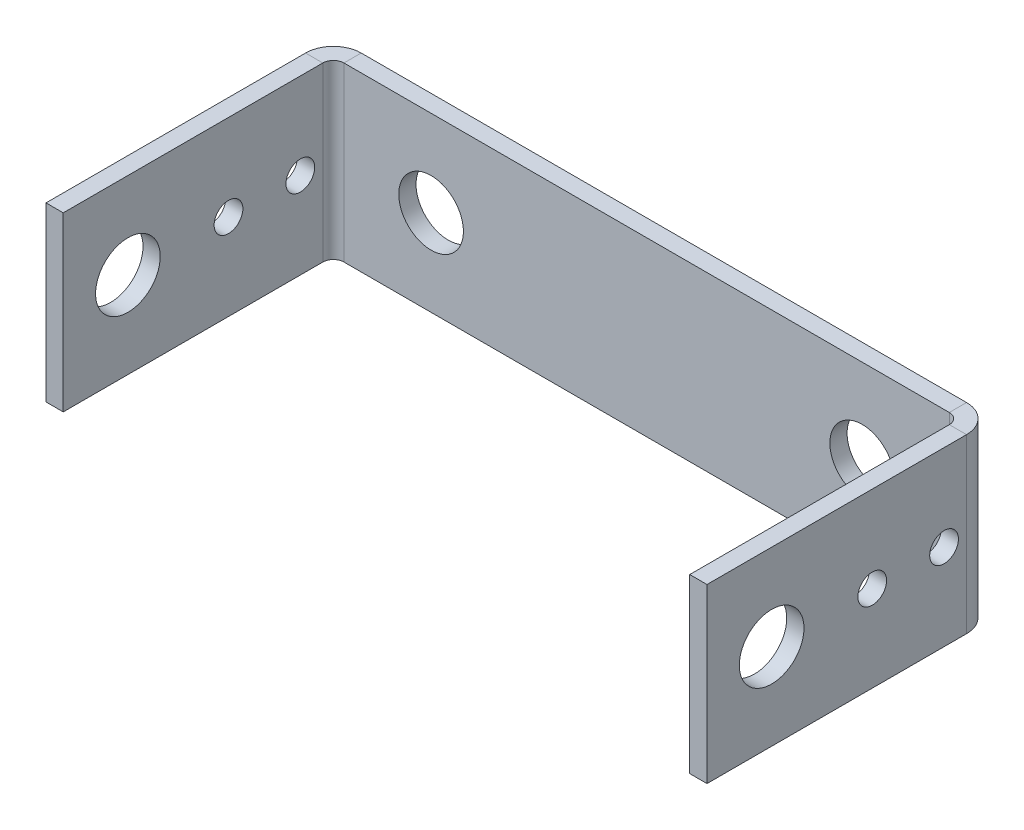
from build123d import *

# Parameters (mm, degrees)
SKETCH_1_W                         = 46
SKETCH_1_H                         = 12
SKETCH_1_R                         = 2.25
SM_BASE_FLANGE_1_DEPTH             = 1.2
SM_EDGE_FLANGE_1_STRIP_W           = 6.2732
SM_EDGE_FLANGE_1_STRIP_H           = 1.2
SM_EDGE_FLANGE_1_STRIP_CUT_DEPTH   = 12
SM_EDGE_FLANGE_1_STRIP_2_W         = 6.2732
SM_EDGE_FLANGE_1_STRIP_2_H         = 1.2
SM_EDGE_FLANGE_1_STRIP_CUT_2_DEPTH = 12
SM_EDGE_FLANGE_1_DEPTH             = 12
SM_EDGE_FLANGE_1_BEND_DEPTH        = 12
SKETCH_12_R                        = 2.25
SKETCH_12_R_2                      = 1
CUT_EXTRUDE_1_DEPTH                = 52.121815304


# Sheet-metal steps are written as plain solids
with BuildPart() as part:
    # Sketch 1 → Базовая кромка1 (new body)
    with BuildSketch(Plane.XY):
        with Locations((23, 6)):
            Rectangle(SKETCH_1_W, SKETCH_1_H)
        with Locations((8, 6)):
            Circle(SKETCH_1_R, mode=Mode.SUBTRACT)
        with Locations((38, 6)):
            Circle(SKETCH_1_R, mode=Mode.SUBTRACT)
    extrude(amount=-SM_BASE_FLANGE_1_DEPTH)

    # Ребро-кромка1 strip (across the edge) → Ребро-кромка1 strip cut (cut)
    with BuildSketch(Plane.XZ.offset(-12)):
        with Locations((-1.2, -0.6)):
            Rectangle(SM_EDGE_FLANGE_1_STRIP_W, SM_EDGE_FLANGE_1_STRIP_H)
    extrude(amount=SM_EDGE_FLANGE_1_STRIP_CUT_DEPTH, mode=Mode.SUBTRACT)

    # Ребро-кромка1 strip 2 (across the edge) → Ребро-кромка1 strip cut 2 (cut)
    with BuildSketch(Plane(origin=(46, 0, 0), x_dir=(-1, 0, 0), z_dir=(0, 1, 0))):
        with Locations((-1.2, -0.6)):
            Rectangle(SM_EDGE_FLANGE_1_STRIP_2_W, SM_EDGE_FLANGE_1_STRIP_2_H)
    extrude(amount=SM_EDGE_FLANGE_1_STRIP_CUT_2_DEPTH, mode=Mode.SUBTRACT)

    # Ребро-кромка1 section (across the edge) → Ребро-кромка1 (add)
    with BuildSketch(Plane.XZ.offset(-12)):
        with BuildLine():
            Line((0, 0.7366), (0, 18.8))
            Line((0, 18.8), (1.2, 18.8))
            Line((1.2, 18.8), (1.2, 0.7366))
            ThreePointArc((1.2, 0.7366), (1.415745145, 0.215745145), (1.9366, 0))
            Line((1.9366, 0), (1.9366, -1.2))
            ThreePointArc((1.9366, -1.2), (0.567217008, -0.632782992), (0, 0.7366))
        make_face()
    extrude(amount=SM_EDGE_FLANGE_1_DEPTH)

    # Ребро-кромка1 section 2 (across the edge) → Ребро-кромка1 bend (add)
    with BuildSketch(Plane(origin=(46, 0, 0), x_dir=(-1, 0, 0), z_dir=(0, 1, 0))):
        with BuildLine():
            Line((0, 0.7366), (0, 18.8))
            Line((0, 18.8), (1.2, 18.8))
            Line((1.2, 18.8), (1.2, 0.7366))
            ThreePointArc((1.2, 0.7366), (1.415745145, 0.215745145), (1.9366, 0))
            Line((1.9366, 0), (1.9366, -1.2))
            ThreePointArc((1.9366, -1.2), (0.567217008, -0.632782992), (0, 0.7366))
        make_face()
    extrude(amount=SM_EDGE_FLANGE_1_BEND_DEPTH)

    # Эскиз12 → Вырез-Вытянуть1 (cut, through all)
    with BuildSketch(Plane(origin=(46, 0, 0), x_dir=(0, 0, -1), z_dir=(1, 0, 0))):
        with Locations((-14.3, 6)):
            Circle(SKETCH_12_R)
        with Locations((-7.3, 6)):
            Circle(SKETCH_12_R_2)
        with Locations((-2.3, 6)):
            Circle(SKETCH_12_R_2)
    extrude(amount=-CUT_EXTRUDE_1_DEPTH, mode=Mode.SUBTRACT)


solid = part.part
